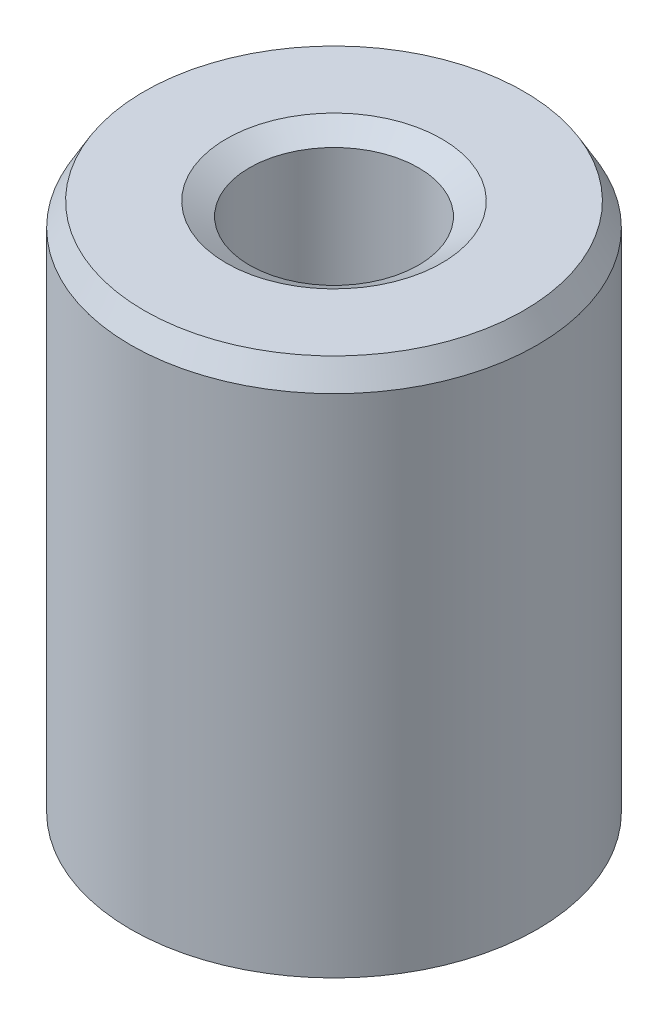
from build123d import *
from OCP.BRepFilletAPI import BRepFilletAPI_MakeChamfer

# Parameters (mm, degrees)
SKETCH1_R           = 5
BOSS_EXTRUDE1_DEPTH = 13.351371207
SKETCH2_R           = 2.078898415
CUT_EXTRUDE1_DEPTH  = 16.108246526
CHAMFER1_SIZE       = 0.571217189
CHAMFER1_SIZE2      = 0.329792398


with BuildPart() as part:
    # Sketch1 → Boss-Extrude1 (new body)
    with BuildSketch(Plane(origin=(0, 0, 0), x_dir=(1, 0, 0), z_dir=(0, 1, 0))):
        Circle(SKETCH1_R)
    extrude(amount=BOSS_EXTRUDE1_DEPTH)

    # Sketch2 → Cut-Extrude1 (cut, through all)
    with BuildSketch(Plane(origin=(0, 0, 0), x_dir=(1, 0, 0), z_dir=(0, 1, 0))):
        Circle(SKETCH2_R)
    extrude(amount=CUT_EXTRUDE1_DEPTH, mode=Mode.SUBTRACT)

    # Chamfer1: one chamfer whose edges measure the first distance from different faces: ONE call of the kernel's chamfer builder (chamfer() names one face for all edges)
    chamfer1_edges_1 = [part.edges().sort_by_distance(p)[0] for p in [
        (-2.078898415, 13.351371207, 0),
    ]]
    chamfer1_side_1 = [part.faces().sort_by_distance(p)[0] for p in [
        (-4.858578644, 13.351371207, 0),
    ]]
    chamfer1_edges_2 = [part.edges().sort_by_distance(p)[0] for p in [
        (-2.078898415, 0, 0),
    ]]
    chamfer1_side_2 = [part.faces().sort_by_distance(p)[0] for p in [
        (-2.078898415, 6.675685603, 0),
    ]]
    chamfer1_edges_3 = [part.edges().sort_by_distance(p)[0] for p in [
        (-5, 0, 0),
    ]]
    chamfer1_side_3 = [part.faces().sort_by_distance(p)[0] for p in [
        (-4.858578644, 0, 0),
    ]]
    chamfer1_edges_4 = [part.edges().sort_by_distance(p)[0] for p in [
        (-5, 13.351371207, 0),
    ]]
    chamfer1_side_4 = [part.faces().sort_by_distance(p)[0] for p in [
        (-5, 6.675685603, 0),
    ]]
    chamfer1 = BRepFilletAPI_MakeChamfer(part.part.solid().wrapped)
    for e in chamfer1_edges_1:
        chamfer1.Add(CHAMFER1_SIZE, CHAMFER1_SIZE2, e.wrapped, chamfer1_side_1[0].wrapped)  # the first distance lies on this face
    for e in chamfer1_edges_2:
        chamfer1.Add(CHAMFER1_SIZE, CHAMFER1_SIZE2, e.wrapped, chamfer1_side_2[0].wrapped)  # the first distance lies on this face
    for e in chamfer1_edges_3:
        chamfer1.Add(CHAMFER1_SIZE, CHAMFER1_SIZE2, e.wrapped, chamfer1_side_3[0].wrapped)  # the first distance lies on this face
    for e in chamfer1_edges_4:
        chamfer1.Add(CHAMFER1_SIZE, CHAMFER1_SIZE2, e.wrapped, chamfer1_side_4[0].wrapped)  # the first distance lies on this face
    add(Compound.cast(chamfer1.Shape()), mode=Mode.REPLACE)


solid = part.part
